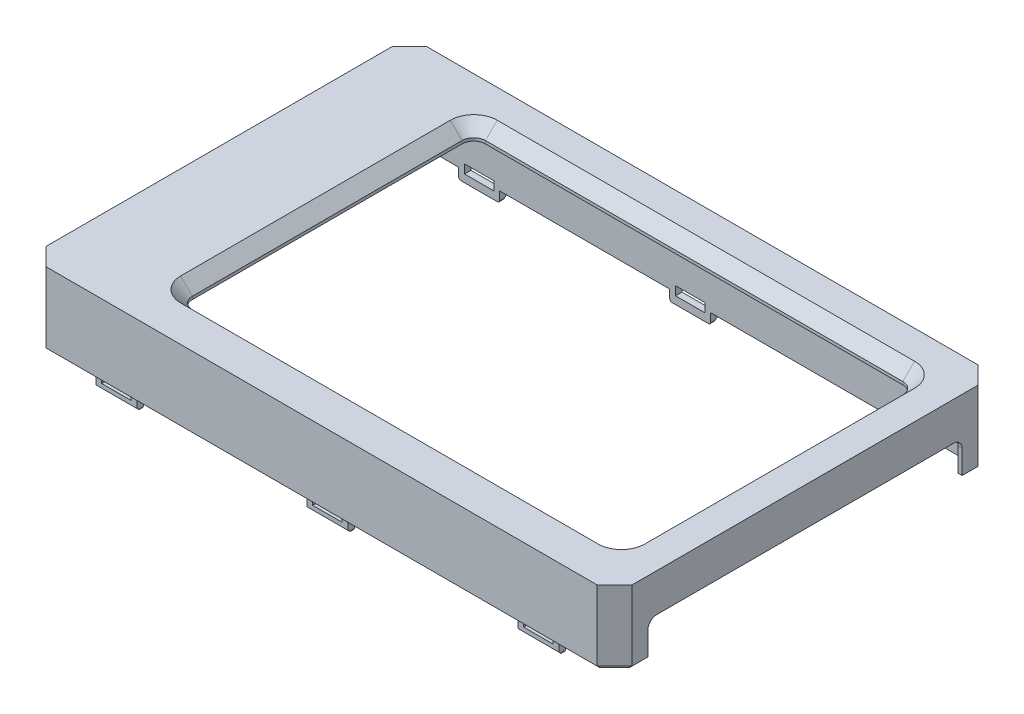
from build123d import *

# Parameters (mm, degrees)
SKETCH_1_W           = 100
SKETCH_1_H           = 65
EXTRUDE_1_DEPTH      = 2
SKETCH_4_W           = 100
SKETCH_4_H           = 65
SKETCH_4_W_2         = 95.8
SKETCH_4_H_2         = 60.8
EXTRUDE_2_DEPTH      = 10
CHAMFER_4_SIZE       = 2
CHAMFER_5_SIZE       = 3
SKETCH_24_W          = 56.6
SKETCH_24_H          = 6
CUT_EXTRUDE_8_DEPTH  = 1.4
FILLET_9_R           = 2
CUT_EXTRUDE_9_DEPTH  = 11.4
EXTRUDE_9_DEPTH      = 1
SKETCH_30_W          = 2.416645626
SKETCH_30_H          = 1.5
EXTRUDE_10_DEPTH     = 6.3
CHAMFER_8_SIZE       = 1
SKETCH_33_W          = 1.5
SKETCH_33_H          = 13
EXTRUDE_11_DEPTH     = 2
SKETCH_21_W          = 20
SKETCH_21_H          = 2
CUT_EXTRUDE_15_DEPTH = 5
FILLET_11_R          = 1
CHAMFER_9_SIZE       = 1
SKETCH_34_W          = 7
SKETCH_34_H          = 2.8
EXTRUDE_12_DEPTH     = 1.1
SKETCH_35_W          = 7
SKETCH_35_H          = 2.8
EXTRUDE_13_DEPTH     = 1.1
CUT_EXTRUDE_16_REACH = 84.25
SKETCH_36_W          = 5
SKETCH_36_H          = 1.5
CUT_EXTRUDE_17_REACH = 84.25
SKETCH_37_W          = 5
SKETCH_37_H          = 1.5
CHAMFER_11_SIZE      = 0.6
FILLET_12_R          = 0.4
CUT_EXTRUDE_18_REACH = 63.492
SKETCH_39_W          = 75.2
SKETCH_39_H          = 50
SKETCH_40_W          = 81.2
SKETCH_40_H          = 56
SKETCH_40_W_2        = 75.2
SKETCH_40_H_2        = 50
EXTRUDE_14_DEPTH     = 0.5
FILLET_13_R          = 2
CHAMFER_12_SIZE      = 2


with BuildPart() as part:
    # 草图1 → 凸台-拉伸1 (new body)
    with BuildSketch(Plane(origin=(0, 0, 0), x_dir=(1, 0, 0), z_dir=(0, 1, 0))):
        Rectangle(SKETCH_1_W, SKETCH_1_H)
    extrude(amount=EXTRUDE_1_DEPTH)

    # 草图4 → 凸台-拉伸2 (add)
    with BuildSketch(Plane.XZ):
        Rectangle(SKETCH_4_W, SKETCH_4_H)
        Rectangle(SKETCH_4_W_2, SKETCH_4_H_2, mode=Mode.SUBTRACT)
    extrude(amount=EXTRUDE_2_DEPTH)

    # 倒角4
    chamfer_4_edges = [part.edges().sort_by_distance(p)[0] for p in [
        (47.9, -5, 30.4),
        (-47.9, -5, 30.4),
        (-47.9, -5, -30.4),
        (47.9, -5, -30.4),
    ]]
    chamfer(chamfer_4_edges, length=CHAMFER_4_SIZE)

    # 倒角5
    chamfer_5_edges = [part.edges().sort_by_distance(p)[0] for p in [
        (50, -4, 32.5),
        (-50, -4, 32.5),
        (-50, -4, -32.5),
        (50, -4, -32.5),
    ]]
    chamfer(chamfer_5_edges, length=CHAMFER_5_SIZE)

    # 草图24 → 切除-拉伸8 (cut)
    with BuildSketch(Plane.ZY.offset(-47.9)):
        with Locations((0, -7)):
            Rectangle(SKETCH_24_W, SKETCH_24_H)
    extrude(amount=-CUT_EXTRUDE_8_DEPTH, mode=Mode.SUBTRACT)

    # 圆角9
    fillet_9_edges = [part.edges().sort_by_distance(p)[0] for p in [
        (48.6, -4, -28.3),
        (48.6, -4, 28.3),
    ]]
    fillet(fillet_9_edges, radius=FILLET_9_R)

    # 草图25 → 切除-拉伸9 (cut)
    with BuildSketch(Plane.ZY.offset(-49.3)):
        with BuildLine():
            Line((26.8, -10), (26.8, -6))
            ThreePointArc((26.8, -6), (26.360660172, -4.939339828), (25.3, -4.5))
            Line((25.3, -4.5), (-25.3, -4.5))
            ThreePointArc((-25.3, -4.5), (-26.360660172, -4.939339828), (-26.8, -6))
            Line((-26.8, -6), (-26.8, -10))
            Line((-26.8, -10), (26.8, -10))
        make_face()
    extrude(amount=-CUT_EXTRUDE_9_DEPTH, mode=Mode.SUBTRACT)

    # 草图26 → 凸台-拉伸9 (add)
    with BuildSketch(Plane.XZ.offset(10)):
        Polygon((45.9, 30.4), (47.9, 28.4), (47.9, 28.3), (49, 28.3), (49, 28.855634919), (46.355634919, 31.5), (-46.355634919, 31.5), (-49, 28.855634919), (-49, -28.855634919), (-46.355634919, -31.5), (46.355634919, -31.5), (49, -28.855634919), (49, -28.3), (47.9, -28.3), (47.9, -28.4), (45.9, -30.4), (-45.9, -30.4), (-47.9, -28.4), (-47.9, 28.4), (-45.9, 30.4), align=None)
    extrude(amount=EXTRUDE_9_DEPTH)

    # 草图30 → 凸台-拉伸10 (add)
    with BuildSketch(Plane.XZ):
        with Locations((46.591677187, 10)):
            Rectangle(SKETCH_30_W, SKETCH_30_H)
        with Locations((46.591677187, -8)):
            Rectangle(SKETCH_30_W, SKETCH_30_H)
    extrude(amount=EXTRUDE_10_DEPTH)

    # 倒角8
    chamfer_8_edges = [part.edges().sort_by_distance(p)[0] for p in [
        (47.8, -6.3, 10),
        (47.8, -6.3, -8),
    ]]
    chamfer(chamfer_8_edges, length=CHAMFER_8_SIZE)

    # 草图33 → 凸台-拉伸11 (add)
    with BuildSketch(Plane(origin=(-47.9, 0, 0), x_dir=(0, 0, -1), z_dir=(1, 0, 0))):
        with Locations((-6.75, -6.5)):
            Rectangle(SKETCH_33_W, SKETCH_33_H)
        with Locations((6.75, -6.5)):
            Rectangle(SKETCH_33_W, SKETCH_33_H)
    extrude(amount=EXTRUDE_11_DEPTH)

    # 草图21 → 切除-拉伸15 (cut)
    with BuildSketch(Plane.ZY.offset(50)):
        with Locations((0, -3)):
            Rectangle(SKETCH_21_W, SKETCH_21_H)
    extrude(amount=-CUT_EXTRUDE_15_DEPTH, mode=Mode.SUBTRACT)

    # 圆角11
    fillet_11_edges = [part.edges().sort_by_distance(p)[0] for p in [
        (-48.95, -2, -10),
        (-48.95, -4, -10),
        (-48.95, -2, 10),
        (-48.95, -4, 10),
    ]]
    fillet(fillet_11_edges, radius=FILLET_11_R - 0.0001)  # a hair under: the kernel refuses the full size

    # 倒角9
    chamfer_9_edges = [part.edges().sort_by_distance(p)[0] for p in [
        (-47.9, -13, 6.75),
        (-47.9, -13, -6.75),
    ]]
    chamfer(chamfer_9_edges, length=CHAMFER_9_SIZE)

    # 草图34 → 凸台-拉伸12 (add)
    with BuildSketch(Plane.XY.offset(-30.4)):
        with Locations((36, -11.4)):
            Rectangle(SKETCH_34_W, SKETCH_34_H)
        with Locations((0, -11.4)):
            Rectangle(SKETCH_34_W, SKETCH_34_H)
        with Locations((-36, -11.4)):
            Rectangle(SKETCH_34_W, SKETCH_34_H)
    extrude(amount=-EXTRUDE_12_DEPTH)

    # 草图35 → 凸台-拉伸13 (add)
    with BuildSketch(Plane(origin=(0, 0, 30.4), x_dir=(-1, 0, 0), z_dir=(0, 0, -1))):
        with Locations((36, -11.4)):
            Rectangle(SKETCH_35_W, SKETCH_35_H)
        with Locations((0, -11.4)):
            Rectangle(SKETCH_35_W, SKETCH_35_H)
        with Locations((-36, -11.4)):
            Rectangle(SKETCH_35_W, SKETCH_35_H)
    extrude(amount=-EXTRUDE_13_DEPTH)

    # 草图36 → 切除-拉伸16 (cut, up to next)
    with BuildSketch(Plane.XY.offset(31.5), mode=Mode.PRIVATE) as cut_extrude_16_sk1:
        with Locations((-36, -10.75)):
            Rectangle(SKETCH_36_W, SKETCH_36_H)
    cut_extrude_16_tool1 = extrude(cut_extrude_16_sk1.sketch, amount=-CUT_EXTRUDE_16_REACH, mode=Mode.PRIVATE) & part.part
    # 草图36 → 切除-拉伸16 (cut, up to next)
    with BuildSketch(Plane.XY.offset(31.5), mode=Mode.PRIVATE) as cut_extrude_16_sk2:
        with Locations((0, -10.75)):
            Rectangle(SKETCH_36_W, SKETCH_36_H)
    cut_extrude_16_tool2 = extrude(cut_extrude_16_sk2.sketch, amount=-CUT_EXTRUDE_16_REACH, mode=Mode.PRIVATE) & part.part
    # 草图36 → 切除-拉伸16 (cut, up to next)
    with BuildSketch(Plane.XY.offset(31.5), mode=Mode.PRIVATE) as cut_extrude_16_sk3:
        with Locations((36, -10.75)):
            Rectangle(SKETCH_36_W, SKETCH_36_H)
    cut_extrude_16_tool3 = extrude(cut_extrude_16_sk3.sketch, amount=-CUT_EXTRUDE_16_REACH, mode=Mode.PRIVATE) & part.part
    add(cut_extrude_16_tool1.solids().sort_by_distance((-36, -10.75, 31.5))[0], mode=Mode.SUBTRACT)
    add(cut_extrude_16_tool2.solids().sort_by_distance((0, -10.75, 31.5))[0], mode=Mode.SUBTRACT)
    add(cut_extrude_16_tool3.solids().sort_by_distance((36, -10.75, 31.5))[0], mode=Mode.SUBTRACT)

    # 草图37 → 切除-拉伸17 (cut, up to next)
    with BuildSketch(Plane(origin=(0, 0, -31.5), x_dir=(-1, 0, 0), z_dir=(0, 0, -1)), mode=Mode.PRIVATE) as cut_extrude_17_sk1:
        with Locations((-36, -10.75)):
            Rectangle(SKETCH_37_W, SKETCH_37_H)
    cut_extrude_17_tool1 = extrude(cut_extrude_17_sk1.sketch, amount=-CUT_EXTRUDE_17_REACH, mode=Mode.PRIVATE) & part.part
    # 草图37 → 切除-拉伸17 (cut, up to next)
    with BuildSketch(Plane(origin=(0, 0, -31.5), x_dir=(-1, 0, 0), z_dir=(0, 0, -1)), mode=Mode.PRIVATE) as cut_extrude_17_sk2:
        with Locations((0, -10.75)):
            Rectangle(SKETCH_37_W, SKETCH_37_H)
    cut_extrude_17_tool2 = extrude(cut_extrude_17_sk2.sketch, amount=-CUT_EXTRUDE_17_REACH, mode=Mode.PRIVATE) & part.part
    # 草图37 → 切除-拉伸17 (cut, up to next)
    with BuildSketch(Plane(origin=(0, 0, -31.5), x_dir=(-1, 0, 0), z_dir=(0, 0, -1)), mode=Mode.PRIVATE) as cut_extrude_17_sk3:
        with Locations((36, -10.75)):
            Rectangle(SKETCH_37_W, SKETCH_37_H)
    cut_extrude_17_tool3 = extrude(cut_extrude_17_sk3.sketch, amount=-CUT_EXTRUDE_17_REACH, mode=Mode.PRIVATE) & part.part
    add(cut_extrude_17_tool1.solids().sort_by_distance((36, -10.75, -31.5))[0], mode=Mode.SUBTRACT)
    add(cut_extrude_17_tool2.solids().sort_by_distance((0, -10.75, -31.5))[0], mode=Mode.SUBTRACT)
    add(cut_extrude_17_tool3.solids().sort_by_distance((-36, -10.75, -31.5))[0], mode=Mode.SUBTRACT)

    # 倒角11
    chamfer_11_edges = [part.edges().sort_by_distance(p)[0] for p in [
        (36, -12.8, -31.5),
        (0, -12.8, -31.5),
        (-36, -12.8, -31.5),
        (-36, -12.8, 31.5),
        (0, -12.8, 31.5),
        (36, -12.8, 31.5),
    ]]
    chamfer(chamfer_11_edges, length=CHAMFER_11_SIZE)

    # 圆角12
    fillet_12_edges = [part.edges().sort_by_distance(p)[0] for p in [
        (32.5, -12.8, -30.65),
        (39.5, -12.8, -30.65),
        (-3.5, -12.8, -30.65),
        (3.5, -12.8, -30.65),
        (-39.5, -12.8, -30.65),
        (-32.5, -12.8, -30.65),
        (39.5, -12.8, 30.65),
        (32.5, -12.8, 30.65),
        (3.5, -12.8, 30.65),
        (-3.5, -12.8, 30.65),
        (-32.5, -12.8, 30.65),
        (-39.5, -12.8, 30.65),
    ]]
    fillet(fillet_12_edges, radius=FILLET_12_R)

    # 草图39 → 切除-拉伸18 (cut, up to next)
    with BuildSketch(Plane(origin=(0, 2, 0), x_dir=(1, 0, 0), z_dir=(0, 1, 0)), mode=Mode.PRIVATE) as cut_extrude_18_sk1:
        with Locations((5.447399795, 0.63)):
            Rectangle(SKETCH_39_W, SKETCH_39_H)
    cut_extrude_18_tool1 = extrude(cut_extrude_18_sk1.sketch, amount=-CUT_EXTRUDE_18_REACH, mode=Mode.PRIVATE) & part.part
    add(cut_extrude_18_tool1.solids().sort_by_distance((5.4474, 2, -0.63))[0], mode=Mode.SUBTRACT)

    # 草图40 → 凸台-拉伸14 (add)
    with BuildSketch(Plane.XZ):
        with Locations((5.447399795, -0.63)):
            Rectangle(SKETCH_40_W, SKETCH_40_H)
        with Locations((5.447399795, -0.63)):
            Rectangle(SKETCH_40_W_2, SKETCH_40_H_2, mode=Mode.SUBTRACT)
    extrude(amount=EXTRUDE_14_DEPTH)

    # 圆角13
    fillet_13_edges = [part.edges().sort_by_distance(p)[0] for p in [
        (-32.152600205, 0.75, 24.37),
        (-32.152600205, 0.75, -25.63),
        (43.047399795, 0.75, -25.63),
        (43.047399795, 0.75, 24.37),
    ]]
    fillet(fillet_13_edges, radius=FILLET_13_R)

    # 倒角12
    chamfer_12_edges = [part.edges().sort_by_distance(p)[0] for p in [
        (5.447399795, 2, 24.37),
        (-32.152600205, 2, -0.63),
        (43.047399795, 2, -0.63),
        (5.447399795, 2, -25.63),
        (-31.566813768, 2, 23.784213562),
        (42.461613357, 2, 23.784213562),
        (42.461613357, 2, -25.044213562),
        (-31.566813768, 2, -25.044213562),
    ]]
    chamfer(chamfer_12_edges, length=CHAMFER_12_SIZE)


solid = part.part
